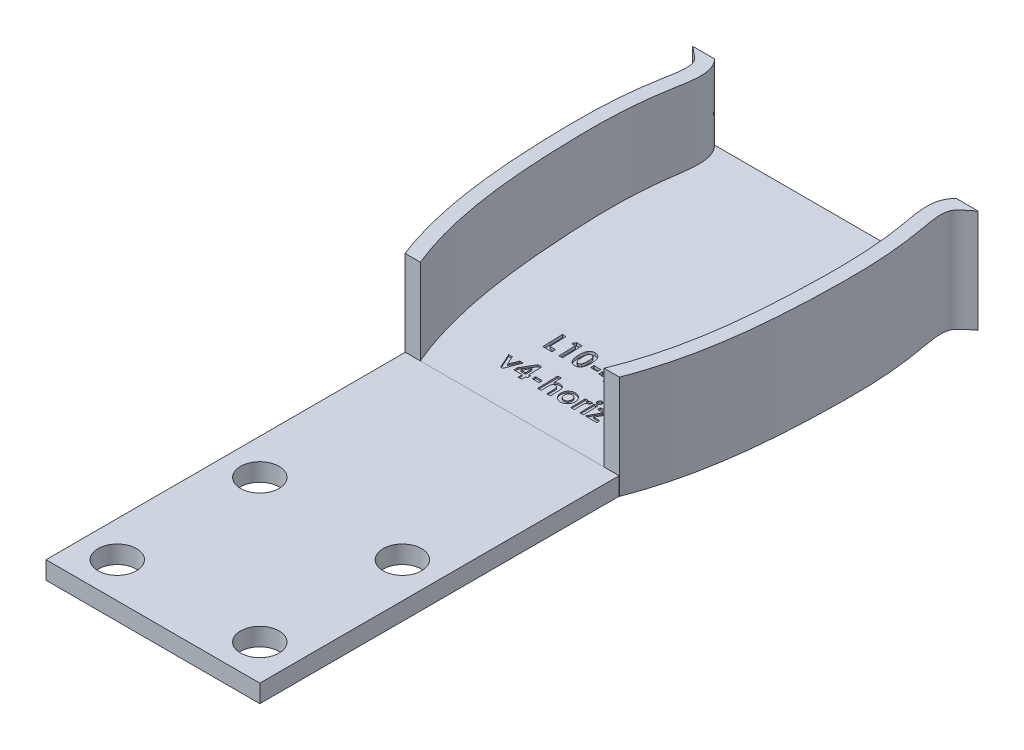
from build123d import *

# Parameters (mm, degrees)
BOSS_EXTRUDE1_DEPTH             = 15.24
BOSS_EXTRUDE2_DEPTH             = 3.175
CUT_EXTRUDE1_DEPTH              = 101.737499619
CUT_EXTRUDE1_DEPTH_BACK         = 101.737499619
SKETCH4_W                       = 67.36433317
SKETCH4_H                       = 14.054429222
CUT_EXTRUDE2_DEPTH              = 101.737499619
CUT_EXTRUDE2_DEPTH_BACK         = 101.737499619
SKETCH5_W                       = 49.650139024
SKETCH5_H                       = 11.35292813
BOSS_EXTRUDE3_REACH             = 96.519
BOSS_EXTRUDE3_DIRECTION_2_REACH = 96.519
SKETCH7_W                       = 1.211538461
SKETCH7_H                       = 0.583333334
SKETCH7_H_2                     = 0.583333333
SKETCH7_W_2                     = 0.628205128
SKETCH7_H_3                     = 2.557692308
CUT_EXTRUDE3_DEPTH              = 2.54
SKETCH11_W                      = 38.1
SKETCH11_H                      = 88.9
SKETCH11_R                      = 3.429
BOSS_EXTRUDE6_DEPTH             = 3.175
CUT_EXTRUDE4_DEPTH              = 157.043467742
CUT_EXTRUDE4_DEPTH_BACK         = 157.043467742
SKETCH12_W                      = 112.801387232
SKETCH12_H                      = 24.1179285


with BuildPart() as part:
    # Sketch1 → Boss-Extrude1 (new body)
    with BuildSketch(Plane(origin=(0, 0, 0), x_dir=(1, 0, 0), z_dir=(0, 1, 0))):
        with BuildLine():
            Line((-22.7965, -3.2766), (0, -3.2766))
            Line((0, -3.2766), (0, -0.7366))
            Line((0, -0.7366), (-23.473368624, -0.7366))
            add(Edge.make_bspline(
                [(-16.036234965, -94.996), (-16.266668515, -94.550702961), (-16.720701659, -93.682415389), (-17.683439589, -91.767388196), (-19.157523694, -88.422224636), (-20.864560475, -83.469769024), (-22.322486613, -77.397632478), (-23.304096417, -71.250607736), (-23.905448462, -65.107414018), (-24.214039592, -59.024976794), (-24.354444297, -53.118128932), (-24.272154011, -48.13674982), (-23.953676725, -43.998708308), (-23.629989314, -41.340657214), (-23.277277512, -39.131677721), (-22.974921231, -37.500648633), (-22.739245926, -36.019201003), (-22.639830007, -34.730271156), (-22.716569087, -33.731143322), (-22.897659106, -33.187469417), (-23.080713281, -32.873112803), (-23.418038091, -32.44515636), (-24.137304718, -31.779192766), (-25.345169697, -30.851423932), (-26.719709236, -29.757875503), (-27.874671748, -28.583220413), (-28.679184219, -27.341372966), (-29.272750801, -25.901376523), (-29.52036248, -24.243876032), (-29.540193255, -22.474579202), (-29.5411543, -20.975677511), (-29.608741981, -19.393014324), (-29.69894001, -17.767125256), (-29.821990808, -15.552264072), (-29.909753679, -12.730710637), (-29.665723992, -9.330406242), (-28.898982584, -6.526282911), (-27.745505353, -4.408806497), (-26.771439175, -3.190317526), (-25.839763004, -2.309659584), (-25.19459958, -1.802530754), (-24.645440816, -1.427178175), (-24.281355495, -1.200536295), (-23.995705767, -1.036197531), (-23.772588374, -0.908307956), (-23.591180554, -0.804189707), (-23.473368624, -0.7366)],
                knots=[-0.006638515, -0.006638515, -0.006638515, -0.006638515, 0.009346854, 0.025332222, 0.057302959, 0.121244433, 0.185185906, 0.24912738, 0.313068853, 0.377010327, 0.4409518, 0.504893274, 0.536864011, 0.568834748, 0.584820116, 0.600805484, 0.616790853, 0.632776221, 0.648761589, 0.664746958, 0.672739642, 0.680732326, 0.696717695, 0.712703063, 0.728688431, 0.7446738, 0.752666484, 0.760659168, 0.776644537, 0.792629905, 0.808615273, 0.824600642, 0.84058601, 0.856571379, 0.888542115, 0.920512852, 0.952483589, 0.968468957, 0.984454326, 0.99244701, 1.000439694, 1.004436036, 1.008432378, 1.010430549, 1.01242872, 1.016425062, 1.016425062, 1.016425062, 1.016425062], degree=3))
            Line((-16.036234965, -94.996), (0, -94.996))
            Line((0, -94.996), (0, -92.456))
            Line((0, -92.456), (-14.4907, -92.456))
            add(Edge.make_bspline(
                [(-22.7965, -3.2766), (-28.943005337, -6.802902412), (-26.641163365, -16.369853549), (-27.205584149, -27.56197211), (-18.872342179, -30.7914771), (-21.757516457, -42.996088051), (-22.000621659, -62.486681847), (-20.222436581, -81.379811959), (-14.4907, -92.456)],
                knots=[0, 0, 0, 0, 0.208497884, 0.25519267, 0.340986981, 0.42476814, 0.602384632, 1, 1, 1, 1], degree=3))
        make_face()
    boss_extrude1 = extrude(amount=BOSS_EXTRUDE1_DEPTH)

    # Mirror1: Boss-Extrude1 across plane
    add(boss_extrude1.mirror(Plane(origin=(0, 0, 0), x_dir=(0, 0, 1), z_dir=(1, 0, 0))))

    # Sketch3 → Boss-Extrude2 (add)
    with BuildSketch(Plane(origin=(0, 0, 0), x_dir=(1, 0, 0), z_dir=(0, 1, 0))):
        with BuildLine():
            Line((-16.036234965, -94.996), (16.036234965, -94.996))
            add(Edge.make_bspline(
                [(16.036234965, -94.996), (16.266668515, -94.550702961), (16.720701659, -93.682415389), (17.683439589, -91.767388196), (19.157523694, -88.422224636), (20.864560475, -83.469769024), (22.322486613, -77.397632478), (23.304096417, -71.250607736), (23.905448462, -65.107414018), (24.214039592, -59.024976794), (24.354444297, -53.118128932), (24.272154011, -48.13674982), (23.953676725, -43.998708308), (23.629989314, -41.340657214), (23.277277512, -39.131677721), (22.974921231, -37.500648633), (22.739245926, -36.019201003), (22.639830007, -34.730271156), (22.716569087, -33.731143322), (22.897659106, -33.187469417), (23.080713281, -32.873112803), (23.418038091, -32.44515636), (24.137304718, -31.779192766), (25.345169697, -30.851423932), (26.719709236, -29.757875503), (27.874671748, -28.583220413), (28.679184219, -27.341372966), (29.272750801, -25.901376523), (29.52036248, -24.243876032), (29.540193255, -22.474579202), (29.5411543, -20.975677511), (29.608741981, -19.393014324), (29.69894001, -17.767125256), (29.821990808, -15.552264072), (29.909753679, -12.730710637), (29.665723992, -9.330406242), (28.898982584, -6.526282911), (27.745505353, -4.408806497), (26.771439175, -3.190317526), (25.839763004, -2.309659584), (25.19459958, -1.802530754), (24.645440816, -1.427178175), (24.281355495, -1.200536295), (23.995705767, -1.036197531), (23.772588374, -0.908307956), (23.591180554, -0.804189707), (23.473368624, -0.7366)],
                knots=[-0.006638515, -0.006638515, -0.006638515, -0.006638515, 0.009346854, 0.025332222, 0.057302959, 0.121244433, 0.185185906, 0.24912738, 0.313068853, 0.377010327, 0.4409518, 0.504893274, 0.536864011, 0.568834748, 0.584820116, 0.600805484, 0.616790853, 0.632776221, 0.648761589, 0.664746958, 0.672739642, 0.680732326, 0.696717695, 0.712703063, 0.728688431, 0.7446738, 0.752666484, 0.760659168, 0.776644537, 0.792629905, 0.808615273, 0.824600642, 0.84058601, 0.856571379, 0.888542115, 0.920512852, 0.952483589, 0.968468957, 0.984454326, 0.99244701, 1.000439694, 1.004436036, 1.008432378, 1.010430549, 1.01242872, 1.016425062, 1.016425062, 1.016425062, 1.016425062], degree=3))
            Line((23.473368624, -0.7366), (-23.473368624, -0.7366))
            add(Edge.make_bspline(
                [(-23.473368624, -0.7366), (-23.591180554, -0.804189707), (-23.772588374, -0.908307956), (-23.995705767, -1.036197531), (-24.281355495, -1.200536295), (-24.645440816, -1.427178175), (-25.19459958, -1.802530754), (-25.839763004, -2.309659584), (-26.771439175, -3.190317526), (-27.745505353, -4.408806497), (-28.898982584, -6.526282911), (-29.665723992, -9.330406242), (-29.909753679, -12.730710637), (-29.821990808, -15.552264072), (-29.69894001, -17.767125256), (-29.608741981, -19.393014324), (-29.5411543, -20.975677511), (-29.540193255, -22.474579202), (-29.52036248, -24.243876032), (-29.272750801, -25.901376523), (-28.679184219, -27.341372966), (-27.874671748, -28.583220413), (-26.719709236, -29.757875503), (-25.345169697, -30.851423932), (-24.137304718, -31.779192766), (-23.418038091, -32.44515636), (-23.080713281, -32.873112803), (-22.897659106, -33.187469417), (-22.716569087, -33.731143322), (-22.639830007, -34.730271156), (-22.739245926, -36.019201003), (-22.974921231, -37.500648633), (-23.277277512, -39.131677721), (-23.629989314, -41.340657214), (-23.953676725, -43.998708308), (-24.272154011, -48.13674982), (-24.354444297, -53.118128932), (-24.214039592, -59.024976794), (-23.905448462, -65.107414018), (-23.304096417, -71.250607736), (-22.322486613, -77.397632478), (-20.864560475, -83.469769024), (-19.157523694, -88.422224636), (-17.683439589, -91.767388196), (-16.720701659, -93.682415389), (-16.266668515, -94.550702961), (-16.036234965, -94.996)],
                knots=[-0.006638515, -0.006638515, -0.006638515, -0.006638515, -0.002642173, -0.000644001, 0.00135417, 0.005350512, 0.009346854, 0.017339538, 0.025332222, 0.041317591, 0.057302959, 0.089273696, 0.121244433, 0.153215169, 0.169200538, 0.185185906, 0.201171274, 0.217156643, 0.233142011, 0.24912738, 0.257120064, 0.265112748, 0.281098116, 0.297083485, 0.313068853, 0.329054222, 0.337046906, 0.34503959, 0.361024958, 0.377010327, 0.392995695, 0.408981064, 0.424966432, 0.4409518, 0.472922537, 0.504893274, 0.568834748, 0.632776221, 0.696717695, 0.760659168, 0.824600642, 0.888542115, 0.952483589, 0.984454326, 1.000439694, 1.016425062, 1.016425062, 1.016425062, 1.016425062], degree=3))
        make_face()
    extrude(amount=-BOSS_EXTRUDE2_DEPTH)

    # Sketch4 → Cut-Extrude1 (cut, two sides: drawn at the far end of the back side and taken through both)
    with BuildSketch(Plane(origin=(0, 0, 0), x_dir=(1, 0, 0), z_dir=(0, 1, 0)).offset(-CUT_EXTRUDE1_DEPTH_BACK)):
        with Locations((-0.681036793, 0.354931298)):
            Rectangle(SKETCH4_W, SKETCH4_H)
    extrude(amount=CUT_EXTRUDE1_DEPTH + CUT_EXTRUDE1_DEPTH_BACK, mode=Mode.SUBTRACT)

    # Sketch5 → Cut-Extrude2 (cut, two sides: drawn at the far end of the back side and taken through both)
    with BuildSketch(Plane(origin=(0, 0, 0), x_dir=(1, 0, 0), z_dir=(0, 1, 0)).offset(-CUT_EXTRUDE2_DEPTH_BACK)):
        with Locations((-1.165062558, -94.05095474)):
            Rectangle(SKETCH5_W, SKETCH5_H)
    extrude(amount=CUT_EXTRUDE2_DEPTH + CUT_EXTRUDE2_DEPTH_BACK, mode=Mode.SUBTRACT)

    # Sketch6 → Boss-Extrude3 (add, up to next)
    with BuildSketch(Plane(origin=(0, 0, 0), x_dir=(0, 0, -1), z_dir=(1, 0, 0)), mode=Mode.PRIVATE) as boss_extrude3_sk1:
        Polygon((-88.374490675, -3.175), (-6.672283313, -3.175), (-6.672283313, 2.54), (-13.022283313, 2.54), (-88.374490675, 0), align=None)
    boss_extrude3_tool1 = extrude(boss_extrude3_sk1.sketch, amount=BOSS_EXTRUDE3_REACH, mode=Mode.PRIVATE) - part.part
    add(boss_extrude3_tool1.solids().sort_by_distance((0, -0.83586, 43.467493))[0])

    # Sketch6 → Boss-Extrude3 direction 2 (add, up to next)
    with BuildSketch(Plane(origin=(0, 0, 0), x_dir=(0, 0, -1), z_dir=(1, 0, 0)), mode=Mode.PRIVATE) as boss_extrude3_direction_2_sk1:
        Polygon((-88.374490675, -3.175), (-6.672283313, -3.175), (-6.672283313, 2.54), (-13.022283313, 2.54), (-88.374490675, 0), align=None)
    boss_extrude3_direction_2_tool1 = extrude(boss_extrude3_direction_2_sk1.sketch, amount=-BOSS_EXTRUDE3_DIRECTION_2_REACH, mode=Mode.PRIVATE) - part.part
    add(boss_extrude3_direction_2_tool1.solids().sort_by_distance((0, -0.83586, 43.467493))[0])

    # Sketch7 → Cut-Extrude3 (cut)
    # profile 1 of 15: a face of its own
    with BuildSketch(Plane(origin=(0, 2.54, 0), x_dir=(1, 0, 0), z_dir=(0, 1, 0))):
        Polygon((-7.246794872, -72.174490675), (-6.618589744, -72.174490675), (-6.618589744, -75.046285547), (-5.631410256, -75.046285547), (-5.631410256, -75.674490675), (-7.246794872, -75.674490675), align=None)
    # profile 2 of 15: a face of its own
    with BuildSketch(Plane(origin=(0, 2.54, 0), x_dir=(1, 0, 0), z_dir=(0, 1, 0))):
        Polygon((-4.717848558, -72.174490675), (-3.746794872, -72.174490675), (-3.746794872, -75.674490675), (-4.375, -75.674490675), (-4.375, -72.757824008), (-5.092948718, -72.757824008), align=None)
    # profile 3 of 15: a face of its own
    with BuildSketch(Plane(origin=(0, 2.54, 0), x_dir=(1, 0, 0), z_dir=(0, 1, 0))):
        with BuildLine():
            add(Edge.make_bspline(
                [(-1.491286058, -72.084747085), (-1.460878322, -72.085198497), (-1.40108859, -72.086086092), (-1.313029568, -72.095699474), (-1.228204384, -72.110222612), (-1.14628119, -72.130477326), (-1.067849677, -72.157283718), (-0.992339006, -72.189370509), (-0.920647972, -72.228420719), (-0.851862284, -72.272529937), (-0.786008439, -72.322467824), (-0.724669188, -72.379399594), (-0.666724347, -72.442015245), (-0.613428207, -72.511261412), (-0.56360051, -72.586508228), (-0.51740498, -72.667767625), (-0.475195256, -72.755437314), (-0.436498268, -72.849675501), (-0.4018953, -72.951894776), (-0.372749262, -73.063267638), (-0.347751657, -73.183819522), (-0.326651915, -73.313850499), (-0.310703921, -73.453533411), (-0.299954651, -73.602775461), (-0.292577994, -73.761288931), (-0.291975963, -73.870027869), (-0.291666667, -73.925892919)],
                knots=[0, 0, 0, 0, 0.879237366, 1.728815576, 2.559023295, 3.367336655, 4.166867292, 4.954216142, 5.737608147, 6.525189134, 7.316157332, 8.124696809, 8.942788509, 9.781158001, 10.649253743, 11.551476218, 12.482711956, 13.461909668, 14.496590415, 15.601789533, 16.789733467, 18.056700938, 19.410929216, 20.8549011, 22.384193279, 24, 24, 24, 24], degree=3))
            add(Edge.make_bspline(
                [(-0.291666667, -73.925892919), (-0.292000932, -73.982456903), (-0.292650404, -74.09235971), (-0.299648002, -74.252323025), (-0.311698196, -74.402648661), (-0.327229357, -74.543321067), (-0.348502798, -74.674265956), (-0.373416955, -74.795822386), (-0.403023054, -74.907946297), (-0.438765834, -75.01038505), (-0.477228588, -75.10478874), (-0.519553773, -75.192287494), (-0.565003668, -75.273118306), (-0.612535788, -75.34850062), (-0.664756019, -75.416212204), (-0.719122656, -75.478555604), (-0.778002919, -75.533156082), (-0.83891772, -75.5828275), (-0.904098617, -75.625753573), (-0.972873414, -75.663296009), (-1.046468248, -75.693747384), (-1.12354161, -75.720232363), (-1.205407231, -75.73924572), (-1.290764278, -75.754332195), (-1.380576413, -75.762669906), (-1.441724132, -75.763704254), (-1.473056891, -75.764234265)],
                knots=[0, 0, 0, 0, 1.643780988, 3.193836972, 4.651895693, 6.025988579, 7.305620092, 8.505800249, 9.631074763, 10.672816429, 11.65661981, 12.592235626, 13.49536222, 14.350718032, 15.179365177, 15.97804903, 16.751647189, 17.51006938, 18.259804725, 19.016521909, 19.783502495, 20.571750527, 21.382245291, 22.22305063, 23.089471752, 24, 24, 24, 24], degree=3))
            add(Edge.make_bspline(
                [(-1.473056891, -75.764234265), (-1.504388804, -75.76369403), (-1.565767561, -75.762635718), (-1.655822557, -75.754394189), (-1.741631953, -75.739184605), (-1.824145262, -75.720086393), (-1.902788206, -75.693805985), (-1.977937874, -75.662443527), (-2.049016431, -75.625135337), (-2.116220682, -75.58210925), (-2.179321173, -75.532770171), (-2.239298484, -75.477645837), (-2.296019943, -75.416875974), (-2.348622676, -75.34977991), (-2.397968162, -75.277253236), (-2.443541808, -75.198467734), (-2.485316223, -75.113538113), (-2.52459812, -75.022345991), (-2.558729116, -74.922928105), (-2.589104118, -74.814396666), (-2.613986521, -74.695846975), (-2.633998614, -74.567317118), (-2.649976258, -74.42907939), (-2.661861788, -74.281067069), (-2.668898255, -74.123211213), (-2.669540915, -74.01470902), (-2.669871795, -73.958845643)],
                knots=[0, 0, 0, 0, 0.917216111, 1.796812873, 2.643793957, 3.46689424, 4.273913431, 5.068098542, 5.848489301, 6.620921603, 7.401012384, 8.190319798, 9.003608147, 9.831726257, 10.68377682, 11.569763213, 12.493818149, 13.453288342, 14.474581811, 15.568529029, 16.750744269, 18.018426408, 19.375425659, 20.823733699, 22.36466933, 24, 24, 24, 24], degree=3))
            add(Edge.make_bspline(
                [(-2.669871795, -73.958845643), (-2.669272437, -73.881227878), (-2.668115968, -73.7314634), (-2.653460348, -73.515097273), (-2.631949614, -73.315104269), (-2.600355442, -73.131818926), (-2.561289685, -72.96456241), (-2.511263949, -72.814436518), (-2.454313288, -72.679363923), (-2.405784008, -72.599346104), (-2.382411859, -72.560808784)],
                knots=[0, 0, 0, 0, 1.288568992, 2.486310467, 3.599230591, 4.627010532, 5.572937695, 6.447898582, 7.252493626, 8, 8, 8, 8], degree=3))
            add(Edge.make_bspline(
                [(-2.382411859, -72.560808784), (-2.355235837, -72.522949732), (-2.302101359, -72.448927827), (-2.209194239, -72.351750901), (-2.109377635, -72.268640436), (-2.000601371, -72.201477295), (-1.884585789, -72.148512436), (-1.760334835, -72.111103954), (-1.628307349, -72.089308028), (-1.537641871, -72.086290103), (-1.491286058, -72.084747085)],
                knots=[0, 0, 0, 0, 1.058512271, 2.069600068, 3.047294572, 4.004278952, 4.967380941, 5.939006123, 6.946246673, 8, 8, 8, 8], degree=3))
        make_face()
        with BuildLine():
            add(Edge.make_bspline(
                [(-1.475861378, -72.712952213), (-1.503350223, -72.71425513), (-1.557242952, -72.716809538), (-1.635443868, -72.73849286), (-1.70918245, -72.771983919), (-1.76527342, -72.812285172), (-1.807256953, -72.850918757), (-1.836591148, -72.885880894), (-1.864879356, -72.92489612), (-1.889864926, -72.96972499), (-1.913457827, -73.018756751), (-1.936515202, -73.072213977), (-1.955416195, -73.131409694), (-1.973985919, -73.19533579), (-1.990254731, -73.265759652), (-2.003884428, -73.343256919), (-2.016061364, -73.428331561), (-2.024554923, -73.521039303), (-2.032473468, -73.621283149), (-2.038149857, -73.729286404), (-2.040523012, -73.845019931), (-2.041277366, -73.924723894), (-2.041666667, -73.965856861)],
                knots=[0, 0, 0, 0, 1.076674018, 2.110852608, 3.161083442, 4.239746716, 4.804137807, 5.395870207, 6.026861976, 6.692161227, 7.405688833, 8.16177676, 8.973626916, 9.841385931, 10.773283133, 11.807421078, 12.927755683, 14.143907515, 15.458935494, 16.872852025, 18.386167141, 20, 20, 20, 20], degree=3))
            add(Edge.make_bspline(
                [(-2.041666667, -73.965856861), (-2.041025925, -74.019146608), (-2.039797255, -74.121333649), (-2.033362056, -74.268282172), (-2.020463233, -74.40201716), (-2.004419702, -74.523444986), (-1.981885908, -74.631778156), (-1.955959319, -74.728041605), (-1.923942286, -74.811008205), (-1.886940436, -74.881877841), (-1.84595922, -74.942166494), (-1.801472308, -74.99341212), (-1.754994318, -75.037788414), (-1.705074523, -75.073834731), (-1.651832015, -75.101458967), (-1.595711272, -75.121328739), (-1.53667663, -75.133491853), (-1.496250315, -75.135178486), (-1.475861378, -75.136029136)],
                knots=[0, 0, 0, 0, 1.771748488, 3.397459088, 4.888034009, 6.237357457, 7.467047327, 8.564189669, 9.548206622, 10.417051504, 11.216568818, 11.965764335, 12.669334354, 13.348544111, 14.005342236, 14.656555988, 15.322436492, 16, 16, 16, 16], degree=3))
            add(Edge.make_bspline(
                [(-1.475861378, -75.136029136), (-1.456172125, -75.135447058), (-1.417623015, -75.134307422), (-1.361409779, -75.122609206), (-1.30825055, -75.103590448), (-1.25830583, -75.07668708), (-1.211396975, -75.042475331), (-1.167753246, -75.00080486), (-1.127703795, -74.951260309), (-1.104370804, -74.914490925), (-1.092347756, -74.895544361)],
                knots=[0, 0, 0, 0, 0.992283464, 1.942767638, 2.88273346, 3.832339453, 4.79467288, 5.803907806, 6.868395428, 8, 8, 8, 8], degree=3))
            add(Edge.make_bspline(
                [(-1.092347756, -74.895544361), (-1.078192643, -74.869654486), (-1.048510519, -74.815365517), (-1.014162314, -74.723754907), (-0.985249909, -74.620433281), (-0.960365424, -74.50507909), (-0.943345955, -74.377237365), (-0.928688809, -74.23771876), (-0.921619303, -74.085820717), (-0.92046941, -73.980585205), (-0.919871795, -73.925892919)],
                knots=[0, 0, 0, 0, 0.710965849, 1.490837728, 2.352621235, 3.297892224, 4.334225155, 5.461620853, 6.680770821, 8, 8, 8, 8], degree=3))
            add(Edge.make_bspline(
                [(-0.919871795, -73.925892919), (-0.920102641, -73.870725877), (-0.920546979, -73.76453874), (-0.928699306, -73.612094612), (-0.940052044, -73.472862202), (-0.956657823, -73.347152359), (-0.978024175, -73.234659914), (-1.004358285, -73.135392221), (-1.035404242, -73.049153642), (-1.072221047, -72.97603017), (-1.112997946, -72.913885249), (-1.156283869, -72.860569728), (-1.202261846, -72.815050281), (-1.250854988, -72.77715561), (-1.303188, -72.74820124), (-1.358261252, -72.727757059), (-1.41618765, -72.715389016), (-1.455701654, -72.713775444), (-1.475861378, -72.712952213)],
                knots=[0, 0, 0, 0, 1.793836731, 3.452829483, 4.963243077, 6.335886805, 7.574563692, 8.684454726, 9.672768357, 10.54971625, 11.340229787, 12.085688095, 12.778991901, 13.440269426, 14.083255152, 14.715733572, 15.344777694, 16, 16, 16, 16], degree=3))
        make_face(mode=Mode.SUBTRACT)
    # profile 4 of 15: a face of its own
    with BuildSketch(Plane(origin=(0, 2.54, 0), x_dir=(1, 0, 0), z_dir=(0, 1, 0))):
        with Locations((0.897435898, -74.395644521)):
            Rectangle(SKETCH7_W, SKETCH7_H)
    # profile 5 of 15: a face of its own
    with BuildSketch(Plane(origin=(0, 2.54, 0), x_dir=(1, 0, 0), z_dir=(0, 1, 0))):
        Polygon((3.450921474, -72.084747085), (4.105769231, -72.084747085), (4.105769231, -74.373208624), (4.419871795, -74.373208624), (4.419871795, -74.956541957), (4.105769231, -74.956541957), (4.105769231, -75.674490675), (3.477564103, -75.674490675), (3.477564103, -74.956541957), (1.996794872, -74.956541957), (1.996794872, -74.320624489), align=None)
        Polygon((3.477564103, -74.373208624), (3.477564103, -73.182002694), (2.702824519, -74.373208624), align=None, mode=Mode.SUBTRACT)
    # profile 6 of 15: a face of its own
    with BuildSketch(Plane(origin=(0, 2.54, 0), x_dir=(1, 0, 0), z_dir=(0, 1, 0))):
        Polygon((4.711538462, -72.174490675), (5.382512019, -72.174490675), (6.282051282, -74.66066856), (7.18369391, -72.174490675), (7.852564103, -72.174490675), (6.583533654, -75.674490675), (5.978465545, -75.674490675), align=None)
    # profile 7 of 15: a face of its own
    with BuildSketch(Plane(origin=(0, 2.54, 0), x_dir=(1, 0, 0), z_dir=(0, 1, 0))):
        Polygon((-9.176282051, -79.815516316), (-8.536858974, -79.815516316), (-7.875, -81.32503154), (-7.213141026, -79.815516316), (-6.573717949, -79.815516316), (-7.694110577, -82.373208624), (-8.055889423, -82.373208624), align=None)
    # profile 8 of 15: a face of its own
    with BuildSketch(Plane(origin=(0, 2.54, 0), x_dir=(1, 0, 0), z_dir=(0, 1, 0))):
        Polygon((-4.962540064, -78.783465034), (-4.307692308, -78.783465034), (-4.307692308, -81.071926572), (-3.993589744, -81.071926572), (-3.993589744, -81.655259906), (-4.307692308, -81.655259906), (-4.307692308, -82.373208624), (-4.935897436, -82.373208624), (-4.935897436, -81.655259906), (-6.416666667, -81.655259906), (-6.416666667, -81.019342438), align=None)
        Polygon((-4.935897436, -81.071926572), (-4.935897436, -79.880720643), (-5.710637019, -81.071926572), align=None, mode=Mode.SUBTRACT)
    # profile 9 of 15: a face of its own
    with BuildSketch(Plane(origin=(0, 2.54, 0), x_dir=(1, 0, 0), z_dir=(0, 1, 0))):
        with Locations((-2.80448718, -81.094362469)):
            Rectangle(SKETCH7_W, SKETCH7_H_2)
    # profile 10 of 15: a face of its own
    with BuildSketch(Plane(origin=(0, 2.54, 0), x_dir=(1, 0, 0), z_dir=(0, 1, 0))):
        with BuildLine():
            Line((-1.480769231, -78.783465034), (-0.852564103, -78.783465034))
            Line((-0.852564103, -78.783465034), (-0.852564103, -80.092459425))
            add(Edge.make_bspline(
                [(-0.852564103, -80.092459425), (-0.820920079, -80.066724636), (-0.759240393, -80.016563072), (-0.662462944, -79.951214457), (-0.565885667, -79.895449608), (-0.468483736, -79.850256011), (-0.370679714, -79.814840436), (-0.272304711, -79.789724301), (-0.173264022, -79.7732459), (-0.106868624, -79.771512572), (-0.073617788, -79.770644521)],
                knots=[0, 0, 0, 0, 1.13710654, 2.216417683, 3.252896077, 4.244436563, 5.207303112, 6.149540546, 7.073289332, 8, 8, 8, 8], degree=3))
            add(Edge.make_bspline(
                [(-0.073617788, -79.770644521), (-0.04179897, -79.771488807), (0.020664042, -79.773146212), (0.112301067, -79.78511788), (0.200071037, -79.805718033), (0.284190169, -79.834036516), (0.36407974, -79.872120703), (0.440778625, -79.91673152), (0.513375154, -79.970179452), (0.557546007, -80.011379725), (0.579827724, -80.032162951)],
                knots=[0, 0, 0, 0, 1.056403236, 2.073808271, 3.062028718, 4.046096703, 5.014652014, 5.995532726, 6.988858718, 8, 8, 8, 8], degree=3))
            add(Edge.make_bspline(
                [(0.579827724, -80.032162951), (0.598126896, -80.051582972), (0.634990742, -80.09070478), (0.680903679, -80.158149872), (0.720549041, -80.231614315), (0.752854359, -80.311788447), (0.776880321, -80.398709588), (0.795481288, -80.491661671), (0.805768018, -80.591659624), (0.807037542, -80.660579457), (0.807692308, -80.69612529)],
                knots=[0, 0, 0, 0, 0.887296576, 1.787466942, 2.706642908, 3.663267187, 4.658426068, 5.705361056, 6.816525637, 8, 8, 8, 8], degree=3))
            Line((0.807692308, -80.69612529), (0.807692308, -82.373208624))
            Line((0.807692308, -82.373208624), (0.179487179, -82.373208624))
            Line((0.179487179, -82.373208624), (0.179487179, -81.261229457))
            add(Edge.make_bspline(
                [(0.179487179, -81.261229457), (0.179365118, -81.225938595), (0.179131479, -81.158388245), (0.177033401, -81.061384169), (0.173607173, -80.973259674), (0.168921651, -80.893988129), (0.162379637, -80.823900823), (0.155945107, -80.762495397), (0.146915954, -80.710066189), (0.133395941, -80.653096872), (0.111393316, -80.59216359), (0.07941992, -80.52721133), (0.036712249, -80.473605752), (-0.012711319, -80.42939459), (-0.069856517, -80.395650959), (-0.132677602, -80.370728499), (-0.202248535, -80.356712723), (-0.250471975, -80.354913288), (-0.275540865, -80.353977854)],
                knots=[0, 0, 0, 0, 1.461461505, 2.797388094, 4.017818807, 5.113567707, 6.085313608, 6.932873269, 7.669572396, 8.286941306, 9.355291607, 10.346554054, 11.270113241, 12.175128673, 13.078071705, 14.003657132, 14.962203834, 16, 16, 16, 16], degree=3))
            add(Edge.make_bspline(
                [(-0.275540865, -80.353977854), (-0.308198203, -80.355254537), (-0.37216128, -80.357755065), (-0.463887163, -80.383495003), (-0.548492222, -80.424180244), (-0.624989039, -80.480568157), (-0.691647897, -80.551196263), (-0.747497732, -80.633979457), (-0.79317984, -80.728089728), (-0.81292447, -80.796716564), (-0.823116987, -80.832142919)],
                knots=[0, 0, 0, 0, 0.993549393, 1.945978497, 2.879753144, 3.843180486, 4.826017097, 5.826060929, 6.877775219, 8, 8, 8, 8], degree=3))
            add(Edge.make_bspline(
                [(-0.823116987, -80.832142919), (-0.825654946, -80.843092689), (-0.831442322, -80.86806175), (-0.835874404, -80.910663256), (-0.842451544, -80.962161177), (-0.844733048, -81.022864115), (-0.849006846, -81.092678444), (-0.850543872, -81.171717118), (-0.852091267, -81.260054444), (-0.852401424, -81.321992131), (-0.852564103, -81.354478656)],
                knots=[0, 0, 0, 0, 0.514379255, 1.17295301, 1.959069106, 2.891908278, 3.953016936, 5.163065833, 6.51201855, 8, 8, 8, 8], degree=3))
            Line((-0.852564103, -81.354478656), (-0.852564103, -82.373208624))
            Line((-0.852564103, -82.373208624), (-1.480769231, -82.373208624))
            Line((-1.480769231, -82.373208624), (-1.480769231, -78.783465034))
        make_face()
    # profile 11 of 15: a face of its own
    with BuildSketch(Plane(origin=(0, 2.54, 0), x_dir=(1, 0, 0), z_dir=(0, 1, 0))):
        with BuildLine():
            add(Edge.make_bspline(
                [(2.654447115, -79.770644521), (2.684147441, -79.771173059), (2.742967544, -79.772219803), (2.830572739, -79.78093299), (2.916646393, -79.795148915), (3.001683246, -79.813556057), (3.084893652, -79.839347215), (3.166714039, -79.870279722), (3.247875984, -79.905793856), (3.326365066, -79.948068099), (3.402748309, -79.99391837), (3.475164168, -80.044494981), (3.543011281, -80.099400671), (3.607549121, -80.157362406), (3.665770121, -80.220903653), (3.721394914, -80.286962727), (3.771418228, -80.357906294), (3.817732611, -80.432005624), (3.858965973, -80.508832215), (3.894769565, -80.587851634), (3.925843717, -80.667971382), (3.950174155, -80.750167371), (3.970317515, -80.833355738), (3.983029407, -80.918555895), (3.99206668, -81.004892622), (3.993080045, -81.063021612), (3.993589744, -81.092259104)],
                knots=[0, 0, 0, 0, 1.022364134, 2.024744242, 3.027414945, 4.024939316, 5.017584196, 6.023349371, 7.035562955, 8.064994934, 9.090267829, 10.101425541, 11.102933353, 12.093946398, 13.084502048, 14.067315274, 15.065326281, 16.070028806, 17.074376865, 18.064572984, 19.055292013, 20.030201733, 21.013838017, 21.999348303, 22.993720005, 24, 24, 24, 24], degree=3))
            add(Edge.make_bspline(
                [(3.993589744, -81.092259104), (3.993051841, -81.121725015), (3.99198237, -81.180309925), (3.983356364, -81.267458756), (3.969086025, -81.353059569), (3.950608236, -81.437616655), (3.924913596, -81.520048024), (3.894892151, -81.601568747), (3.858039646, -81.681067666), (3.817296487, -81.75941204), (3.770684322, -81.834296433), (3.720704308, -81.905950684), (3.665312499, -81.972494965), (3.607557575, -82.035993), (3.544700089, -82.09429757), (3.477743364, -82.148355386), (3.40726706, -82.198827327), (3.332764376, -82.244529228), (3.255189568, -82.284685859), (3.175850922, -82.320890339), (3.094284508, -82.351033153), (3.010659132, -82.375613788), (2.924924079, -82.394645958), (2.83726863, -82.407574738), (2.747881561, -82.416566555), (2.687656074, -82.417572549), (2.657251603, -82.418080419)],
                knots=[0, 0, 0, 0, 1.012026251, 2.012137606, 3.004615893, 3.992048833, 4.982446996, 5.968083444, 6.973977695, 7.990229942, 8.999482246, 10.001782172, 10.988562221, 11.971415814, 12.948383116, 13.930088534, 14.925840678, 15.924049238, 16.929462851, 17.924729459, 18.917889337, 19.913673841, 20.916777188, 21.931792057, 22.95587778, 24, 24, 24, 24], degree=3))
            add(Edge.make_bspline(
                [(2.657251603, -82.418080419), (2.612794065, -82.416775502), (2.525167583, -82.414203492), (2.396114491, -82.396585896), (2.272137071, -82.366261394), (2.153033304, -82.323989708), (2.038648469, -82.269820117), (1.929980827, -82.202777021), (1.825949431, -82.124180309), (1.728356183, -82.034694285), (1.638947547, -81.936520013), (1.560838346, -81.831719577), (1.494517314, -81.721863757), (1.440044119, -81.606827283), (1.39800192, -81.486452407), (1.367640279, -81.361099008), (1.350001144, -81.230414736), (1.347450887, -81.141624072), (1.346153846, -81.096465835)],
                knots=[0, 0, 0, 0, 1.029999031, 2.030143771, 3.011211297, 3.982305373, 4.953580601, 5.938004764, 6.935448627, 7.970290061, 9.001484052, 10.007591832, 10.993831261, 11.969999897, 12.951306496, 13.942897864, 14.953773953, 16, 16, 16, 16], degree=3))
            add(Edge.make_bspline(
                [(1.346153846, -81.096465835), (1.347496119, -81.048246738), (1.350134328, -80.953473066), (1.371082873, -80.814627479), (1.404535439, -80.681689408), (1.452554491, -80.555030726), (1.513894606, -80.434417826), (1.588776985, -80.320105095), (1.677571702, -80.212066639), (1.745570674, -80.146721277), (1.780148237, -80.113493079)],
                knots=[0, 0, 0, 0, 1.043912699, 2.05178951, 3.033892, 4.007821512, 4.978932272, 5.95884105, 6.962068106, 8, 8, 8, 8], degree=3))
            add(Edge.make_bspline(
                [(1.780148237, -80.113493079), (1.811876608, -80.08595064), (1.874470114, -80.031615109), (1.976163961, -79.962699396), (2.080286985, -79.903177245), (2.188087145, -79.854238967), (2.299864961, -79.817340294), (2.415047634, -79.790481362), (2.533611215, -79.773983819), (2.613963791, -79.771763277), (2.654447115, -79.770644521)],
                knots=[0, 0, 0, 0, 1.048115528, 2.067714963, 3.060638214, 4.039924844, 5.017819947, 5.994373833, 6.98952318, 8, 8, 8, 8], degree=3))
        make_face()
        with BuildLine():
            add(Edge.make_bspline(
                [(2.668469551, -80.353977854), (2.644147173, -80.35478625), (2.596268308, -80.356377585), (2.525789363, -80.364917854), (2.459129633, -80.382421869), (2.394965134, -80.404682186), (2.334430941, -80.434452223), (2.275869239, -80.469290027), (2.222325108, -80.512885251), (2.171207374, -80.560706024), (2.124803867, -80.613809708), (2.085263672, -80.671666132), (2.049933632, -80.73206183), (2.023144654, -80.797207965), (2.000974214, -80.865323903), (1.985969526, -80.937510191), (1.97552731, -81.012960468), (1.974752124, -81.064644426), (1.974358974, -81.090856861)],
                knots=[0, 0, 0, 0, 1.030650113, 2.02884584, 2.99876339, 3.944280128, 4.900564847, 5.851248946, 6.823638398, 7.81794922, 8.81432732, 9.802856497, 10.78262424, 11.771747962, 12.779760563, 13.812642396, 14.89064281, 16, 16, 16, 16], degree=3))
            add(Edge.make_bspline(
                [(1.974358974, -81.090856861), (1.974819013, -81.117993678), (1.97571807, -81.171027377), (1.985027992, -81.248463709), (2.00038036, -81.321950275), (2.022191264, -81.391373553), (2.049622158, -81.457231856), (2.083276685, -81.519155675), (2.123510029, -81.576772684), (2.169124877, -81.630011933), (2.219071186, -81.678337789), (2.273798448, -81.71980923), (2.331014889, -81.755842409), (2.392039088, -81.784782612), (2.456004326, -81.807126798), (2.52310049, -81.82357807), (2.593680168, -81.832441218), (2.641804355, -81.833967894), (2.666366186, -81.834747085)],
                knots=[0, 0, 0, 0, 1.141730614, 2.231293227, 3.276944405, 4.297399982, 5.28939179, 6.275415646, 7.257752684, 8.24146775, 9.222424823, 10.176631434, 11.126518621, 12.063689483, 13.012557477, 13.974037417, 14.965980454, 16, 16, 16, 16], degree=3))
            add(Edge.make_bspline(
                [(2.666366186, -81.834747085), (2.690940301, -81.834055977), (2.739119833, -81.832701005), (2.809782394, -81.822554402), (2.8772212, -81.806585649), (2.941732751, -81.784049156), (3.002795466, -81.754489502), (3.060643097, -81.718283937), (3.115784539, -81.676235665), (3.166401133, -81.626997992), (3.213255946, -81.573592708), (3.254344815, -81.515671543), (3.288680223, -81.453747709), (3.316841406, -81.388210831), (3.338695067, -81.319150991), (3.353793274, -81.2463115), (3.364241072, -81.169918094), (3.364998727, -81.117536075), (3.365384615, -81.090856861)],
                knots=[0, 0, 0, 0, 1.031504075, 2.022346795, 2.991027682, 3.937587355, 4.885570121, 5.833146507, 6.798790848, 7.791235734, 8.792807298, 9.778388351, 10.766749885, 11.760164525, 12.768777521, 13.802286646, 14.880660483, 16, 16, 16, 16], degree=3))
            add(Edge.make_bspline(
                [(3.365384615, -81.090856861), (3.364918725, -81.064186972), (3.364004496, -81.011851997), (3.35469391, -80.93535527), (3.339492206, -80.862751217), (3.317399989, -80.794349851), (3.29013214, -80.729370821), (3.256454352, -80.668146729), (3.21602259, -80.610979121), (3.170185996, -80.558151465), (3.11949096, -80.510503731), (3.065713895, -80.468013519), (3.007625087, -80.432870849), (2.946314315, -80.403900744), (2.881618461, -80.381612384), (2.813610157, -80.365067878), (2.742080979, -80.356330849), (2.693263136, -80.354770383), (2.668469551, -80.353977854)],
                knots=[0, 0, 0, 0, 1.123894411, 2.205445421, 3.243160173, 4.246488011, 5.231014757, 6.210004299, 7.185865357, 8.177612767, 9.153374344, 10.115157457, 11.061423229, 12.009021698, 12.96873347, 13.94135618, 14.954456845, 16, 16, 16, 16], degree=3))
        make_face(mode=Mode.SUBTRACT)
    # profile 12 of 15: a face of its own
    with BuildSketch(Plane(origin=(0, 2.54, 0), x_dir=(1, 0, 0), z_dir=(0, 1, 0))):
        with BuildLine():
            Line((4.442307692, -79.815516316), (4.980769231, -79.815516316))
            Line((4.980769231, -79.815516316), (4.980769231, -80.130320002))
            add(Edge.make_bspline(
                [(4.980769231, -80.130320002), (4.996001274, -80.102343312), (5.025772934, -80.04766171), (5.080465971, -79.974262489), (5.143299548, -79.912447712), (5.212015858, -79.860924469), (5.286823169, -79.820767159), (5.365718273, -79.792150014), (5.448026225, -79.773552835), (5.504173919, -79.771620939), (5.532552083, -79.770644521)],
                knots=[0, 0, 0, 0, 1.09866127, 2.147379032, 3.14564304, 4.131443017, 5.102343063, 6.064490016, 7.021754664, 8, 8, 8, 8], degree=3))
            add(Edge.make_bspline(
                [(5.532552083, -79.770644521), (5.553158172, -79.771609426), (5.595119525, -79.773574318), (5.659074533, -79.784996264), (5.723952299, -79.805649315), (5.76664746, -79.824244642), (5.788461538, -79.833745483)],
                knots=[0, 0, 0, 0, 0.931404136, 1.896671404, 2.925354185, 4, 4, 4, 4], degree=3))
            Line((5.788461538, -79.833745483), (5.593549679, -80.365896925))
            add(Edge.make_bspline(
                [(5.593549679, -80.365896925), (5.576127343, -80.357479294), (5.543380056, -80.341657389), (5.495836682, -80.32298591), (5.452689099, -80.311593486), (5.425334323, -80.309893637), (5.412660256, -80.30910606)],
                knots=[0, 0, 0, 0, 1.214386998, 2.282580073, 3.20428172, 4, 4, 4, 4], degree=3))
            add(Edge.make_bspline(
                [(5.412660256, -80.30910606), (5.400693472, -80.30962795), (5.377152747, -80.310654598), (5.342407294, -80.319452627), (5.309684313, -80.334624554), (5.277406885, -80.354061299), (5.248121341, -80.381079828), (5.218853886, -80.412358573), (5.193061838, -80.450976343), (5.165843747, -80.493959883), (5.142668516, -80.546571697), (5.122796469, -80.609379361), (5.105090315, -80.683109602), (5.092906064, -80.768153893), (5.081129496, -80.863689283), (5.074119794, -80.97041699), (5.068895374, -81.08799953), (5.068575935, -81.170076387), (5.068409455, -81.212852053)],
                knots=[0, 0, 0, 0, 0.544232178, 1.070598461, 1.618251235, 2.182094276, 2.777567932, 3.425210017, 4.127676488, 4.886675562, 5.738955394, 6.734782583, 7.883056018, 9.186093582, 10.642914445, 12.264202625, 14.053029461, 16, 16, 16, 16], degree=3))
            Line((5.068409455, -81.212852053), (5.070512821, -81.337651733))
            Line((5.070512821, -81.337651733), (5.070512821, -82.373208624))
            Line((5.070512821, -82.373208624), (4.442307692, -82.373208624))
            Line((4.442307692, -82.373208624), (4.442307692, -79.815516316))
        make_face()
    # profile 13 of 15: a face of its own
    with BuildSketch(Plane(origin=(0, 2.54, 0), x_dir=(1, 0, 0), z_dir=(0, 1, 0))):
        with BuildLine():
            add(Edge.make_bspline(
                [(6.370392628, -78.738593239), (6.397468265, -78.739921672), (6.450633886, -78.742530179), (6.526800873, -78.767957316), (6.596706731, -78.807864447), (6.658505447, -78.862617982), (6.709903841, -78.928003718), (6.749174123, -79.001207396), (6.771049961, -79.082314714), (6.774088192, -79.138342801), (6.775641026, -79.166978656)],
                knots=[0, 0, 0, 0, 0.989868614, 1.943702388, 2.910836514, 3.924849579, 4.949916355, 5.946401046, 6.950409252, 8, 8, 8, 8], degree=3))
            add(Edge.make_bspline(
                [(6.775641026, -79.166978656), (6.774143749, -79.19540348), (6.771226235, -79.250790604), (6.748670637, -79.330796852), (6.710976528, -79.403964976), (6.659161839, -79.468379612), (6.598033101, -79.522251309), (6.52965474, -79.56288293), (6.454217654, -79.586895561), (6.401877003, -79.589722124), (6.375300481, -79.591157342)],
                knots=[0, 0, 0, 0, 1.05296456, 2.051751585, 3.055639087, 4.085634717, 5.099016424, 6.062201612, 7.016062274, 8, 8, 8, 8], degree=3))
            add(Edge.make_bspline(
                [(6.375300481, -79.591157342), (6.347988496, -79.589833657), (6.294360336, -79.587234551), (6.217568623, -79.561747921), (6.1467304, -79.522155084), (6.085199766, -79.466282849), (6.033212746, -79.400432498), (5.995657805, -79.325524575), (5.972166261, -79.243862647), (5.969377835, -79.187004746), (5.967948718, -79.157864072)],
                knots=[0, 0, 0, 0, 0.989065327, 1.942068821, 2.907541208, 3.917690034, 4.939857478, 5.938239964, 6.943311734, 8, 8, 8, 8], degree=3))
            add(Edge.make_bspline(
                [(5.967948718, -79.157864072), (5.969503988, -79.129921918), (5.972559092, -79.075033591), (5.994565969, -78.995729526), (6.032935784, -78.923756516), (6.083963951, -78.859567728), (6.145219867, -78.805835552), (6.215083759, -78.767140426), (6.290738139, -78.742763503), (6.343566975, -78.73999768), (6.370392628, -78.738593239)],
                knots=[0, 0, 0, 0, 1.038616768, 2.040212704, 3.031499824, 4.052181184, 5.074969369, 6.039807101, 7.004644834, 8, 8, 8, 8], degree=3))
        make_face()
    # profile 14 of 15: a face of its own
    with BuildSketch(Plane(origin=(0, 2.54, 0), x_dir=(1, 0, 0), z_dir=(0, 1, 0))):
        with Locations((6.371794872, -81.09436247)):
            Rectangle(SKETCH7_W_2, SKETCH7_H_3)
    # profile 15 of 15: a face of its own
    with BuildSketch(Plane(origin=(0, 2.54, 0), x_dir=(1, 0, 0), z_dir=(0, 1, 0))):
        Polygon((7.179487179, -79.815516316), (9.153846154, -79.815516316), (7.977363782, -81.834747085), (9.064102564, -81.834747085), (9.064102564, -82.373208624), (7, -82.373208624), (8.176482372, -80.353977854), (7.179487179, -80.353977854), align=None)
    extrude(amount=-CUT_EXTRUDE3_DEPTH, mode=Mode.SUBTRACT)

    # Sketch11 → Boss-Extrude6 (add)
    with BuildSketch(Plane(origin=(0, 0, 0), x_dir=(1, 0, 0), z_dir=(0, 1, 0))):
        with Locations((0, -107.95)):
            Rectangle(SKETCH11_W, SKETCH11_H)
        with Locations(Location((12.7, -146.05, 0), (0, 0, 270))):
            Circle(SKETCH11_R, mode=Mode.SUBTRACT)
        with Locations(Location((12.7, -120.65, 0), (0, 0, 270))):
            Circle(SKETCH11_R, mode=Mode.SUBTRACT)
        with Locations(Location((-12.7, -120.65, 0), (0, 0, 270))):
            Circle(SKETCH11_R, mode=Mode.SUBTRACT)
        with Locations(Location((-12.7, -146.05, 0), (0, 0, 270))):
            Circle(SKETCH11_R, mode=Mode.SUBTRACT)
    extrude(amount=-BOSS_EXTRUDE6_DEPTH)

    # Sketch12 → Cut-Extrude4 (cut, two sides: drawn at the far end of the back side and taken through both)
    with BuildSketch(Plane(origin=(0, 0, 0), x_dir=(1, 0, 0), z_dir=(0, 1, 0)).offset(-CUT_EXTRUDE4_DEPTH_BACK)):
        with Locations((-7.040257187, -18.731247563)):
            Rectangle(SKETCH12_W, SKETCH12_H)
    extrude(amount=CUT_EXTRUDE4_DEPTH + CUT_EXTRUDE4_DEPTH_BACK, mode=Mode.SUBTRACT)


solid = part.part
